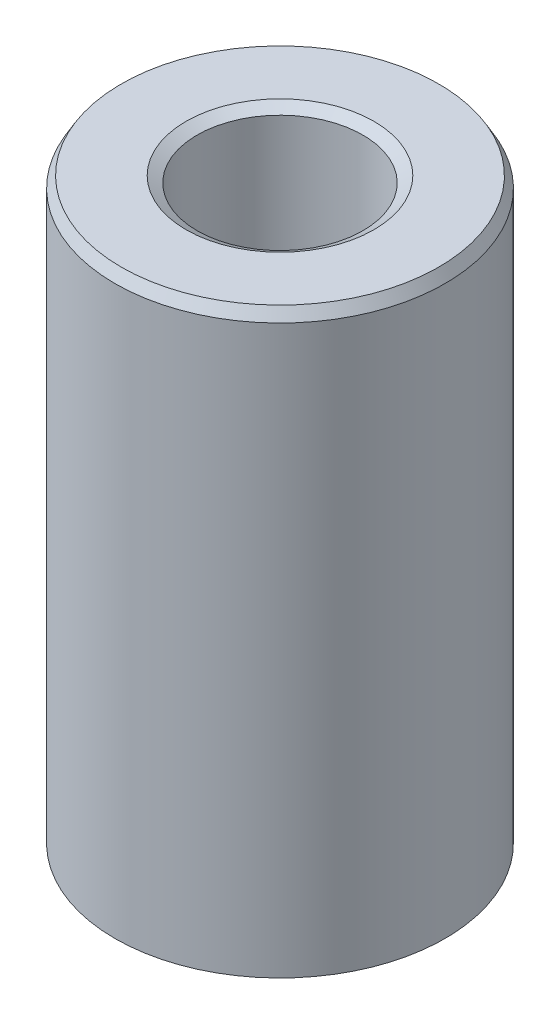
from build123d import *
from OCP.BRepFilletAPI import BRepFilletAPI_MakeChamfer

# Parameters (mm, degrees)
SKETCH1_R           = 7.5
BOSS_EXTRUDE1_DEPTH = 26.561014913
SKETCH2_R           = 3.766812159
CUT_EXTRUDE1_DEPTH  = 29.600480996
CHAMFER1_SIZE       = 0.501340556
CHAMFER1_SIZE2      = 0.289449105


with BuildPart() as part:
    # Sketch1 → Boss-Extrude1 (new body)
    with BuildSketch(Plane(origin=(0, 0, 0), x_dir=(1, 0, 0), z_dir=(0, 1, 0))):
        Circle(SKETCH1_R)
    extrude(amount=BOSS_EXTRUDE1_DEPTH)

    # Sketch2 → Cut-Extrude1 (cut, through all)
    with BuildSketch(Plane(origin=(0, 0, 0), x_dir=(1, 0, 0), z_dir=(0, 1, 0))):
        Circle(SKETCH2_R)
    extrude(amount=CUT_EXTRUDE1_DEPTH, mode=Mode.SUBTRACT)

    # Chamfer1: one chamfer whose edges measure the first distance from different faces: ONE call of the kernel's chamfer builder (chamfer() names one face for all edges)
    chamfer1_edges_1 = [part.edges().sort_by_distance(p)[0] for p in [
        (-3.766812159, 26.561014913, 0),
    ]]
    chamfer1_side_1 = [part.faces().sort_by_distance(p)[0] for p in [
        (-7.287867966, 26.561014913, 0),
    ]]
    chamfer1_edges_2 = [part.edges().sort_by_distance(p)[0] for p in [
        (-3.766812159, 0, 0),
    ]]
    chamfer1_side_2 = [part.faces().sort_by_distance(p)[0] for p in [
        (-3.766812159, 13.280507457, 0),
    ]]
    chamfer1_edges_3 = [part.edges().sort_by_distance(p)[0] for p in [
        (-7.5, 0, 0),
    ]]
    chamfer1_side_3 = [part.faces().sort_by_distance(p)[0] for p in [
        (-7.287867966, 0, 0),
    ]]
    chamfer1_edges_4 = [part.edges().sort_by_distance(p)[0] for p in [
        (-7.5, 26.561014913, 0),
    ]]
    chamfer1_side_4 = [part.faces().sort_by_distance(p)[0] for p in [
        (-7.5, 13.280507457, 0),
    ]]
    chamfer1 = BRepFilletAPI_MakeChamfer(part.part.solid().wrapped)
    for e in chamfer1_edges_1:
        chamfer1.Add(CHAMFER1_SIZE, CHAMFER1_SIZE2, e.wrapped, chamfer1_side_1[0].wrapped)  # the first distance lies on this face
    for e in chamfer1_edges_2:
        chamfer1.Add(CHAMFER1_SIZE, CHAMFER1_SIZE2, e.wrapped, chamfer1_side_2[0].wrapped)  # the first distance lies on this face
    for e in chamfer1_edges_3:
        chamfer1.Add(CHAMFER1_SIZE, CHAMFER1_SIZE2, e.wrapped, chamfer1_side_3[0].wrapped)  # the first distance lies on this face
    for e in chamfer1_edges_4:
        chamfer1.Add(CHAMFER1_SIZE, CHAMFER1_SIZE2, e.wrapped, chamfer1_side_4[0].wrapped)  # the first distance lies on this face
    add(Compound.cast(chamfer1.Shape()), mode=Mode.REPLACE)


solid = part.part
